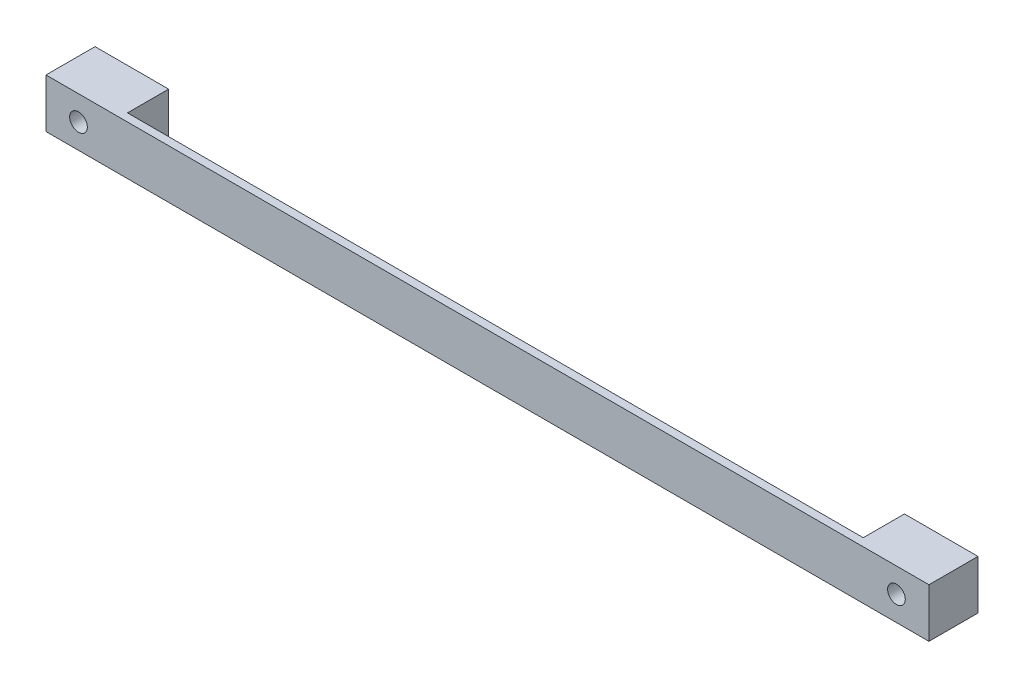
from build123d import *

# Parameters (mm, degrees)
SKETCH1_W           = 228.6
SKETCH1_H           = 12.7
BOSS_EXTRUDE1_DEPTH = 12.7
CUT_EXTRUDE1_DEPTH  = 95.25
SKETCH4_W           = 6.35
SKETCH4_H           = 6.35
CUT_EXTRUDE2_DEPTH  = 6.35
SKETCH5_R           = 2.286
CUT_EXTRUDE3_DEPTH  = 230.04054772


with BuildPart() as part:
    # Sketch1 → Boss-Extrude1 (new body)
    with BuildSketch(Plane.XY):
        with Locations((114.3, 6.35)):
            Rectangle(SKETCH1_W, SKETCH1_H)
    extrude(amount=BOSS_EXTRUDE1_DEPTH)

    # Sketch2 → Cut-Extrude1 (cut, symmetric)
    with BuildSketch(Plane(origin=(114.3, 0, 0), x_dir=(0, 0, -1), z_dir=(1, 0, 0))):
        Polygon((-10.656565316, 12.7), (0, 0), (0, 12.7), align=None)
    extrude(amount=CUT_EXTRUDE1_DEPTH, both=True, mode=Mode.SUBTRACT)

    # Sketch4 → Cut-Extrude2 (cut)
    with BuildSketch(Plane(origin=(0, 0, 0), x_dir=(-1, 0, 0), z_dir=(0, 0, -1))):
        with Locations((-8.41375, 6.35)):
            Rectangle(SKETCH4_W, SKETCH4_H)
    cut_extrude2 = extrude(amount=-CUT_EXTRUDE2_DEPTH, mode=Mode.SUBTRACT)

    # Sketch5 → Cut-Extrude3 (cut, through all)
    with BuildSketch(Plane(origin=(0, 0, 6.35), x_dir=(-1, 0, 0), z_dir=(0, 0, -1))):
        with Locations((-8.41375, 6.35)):
            Circle(SKETCH5_R)
    cut_extrude3 = extrude(amount=-CUT_EXTRUDE3_DEPTH, mode=Mode.SUBTRACT)

    # Mirror1: Cut-Extrude2, Cut-Extrude3 across plane
    add(cut_extrude2.mirror(Plane(origin=(114.3, 0, 0), x_dir=(0, 0, 1), z_dir=(1, 0, 0))), mode=Mode.SUBTRACT)
    add(cut_extrude3.mirror(Plane(origin=(114.3, 0, 0), x_dir=(0, 0, 1), z_dir=(1, 0, 0))), mode=Mode.SUBTRACT)


solid = part.part
